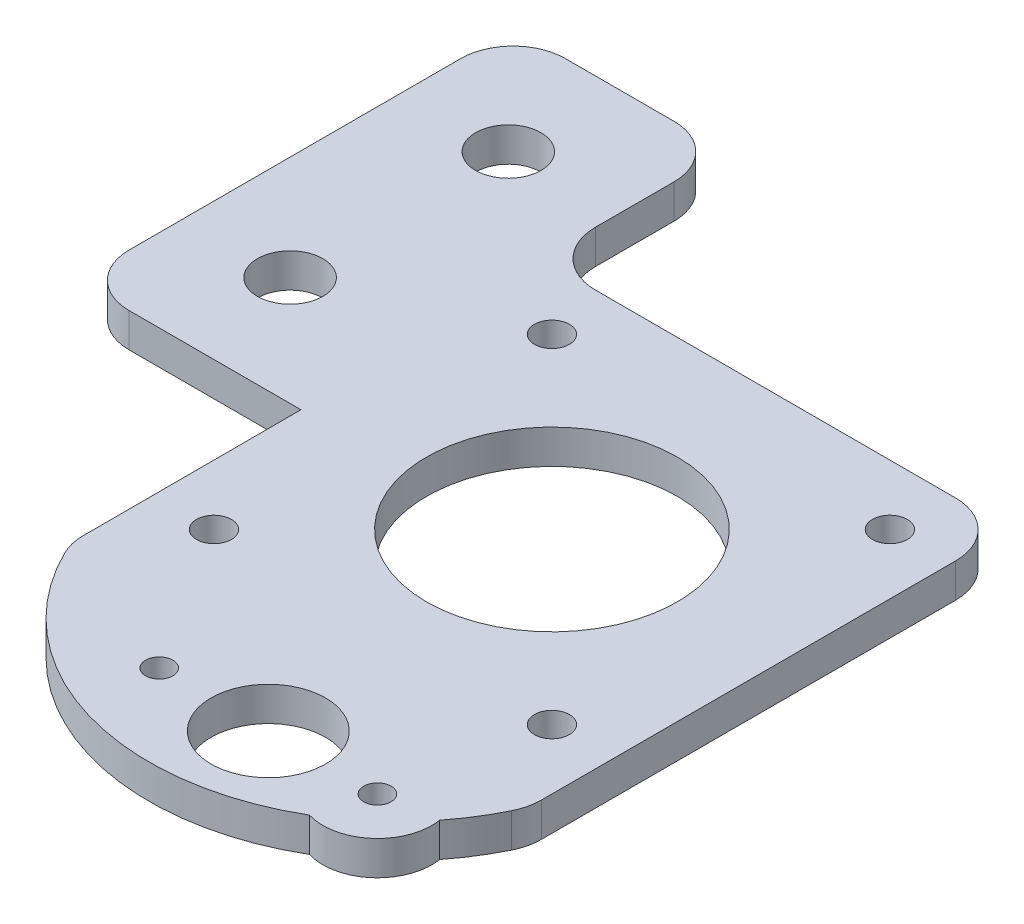
from build123d import *

# Parameters (mm, degrees)
BASE_FLANGE1_DEPTH           = 3.125
F_10_5_10_5_DIAMETER_HOLE1_D = 10.5
F_3_2_3_2_DIAMETER_HOLE1_D   = 3.2
F_23_0_23_DIAMETER_HOLE1_D   = 23
F_6_0_6_DIAMETER_HOLE1_D     = 6
F_2_5_2_5_DIAMETER_HOLE1_D   = 2.5


# Sheet-metal steps are written as plain solids
with BuildPart() as part:
    # Sketch11 → Base-Flange1 (new body)
    with BuildSketch(Plane.XZ.offset(-546.875)):
        with BuildLine():
            Line((22.410254546, -39.506758362), (32.373254546, -39.506758362))
            ThreePointArc((32.373254546, -39.506758362), (35.767367096, -38.100870912), (37.173254546, -34.706758362))
            Line((37.173254546, -34.706758362), (37.173254546, -27.506758362))
            ThreePointArc((37.173254546, -27.506758362), (38.63772064, -23.971224456), (42.173254546, -22.506758362))
            Line((42.173254546, -22.506758362), (75.173254546, -22.506758362))
            ThreePointArc((75.173254546, -22.506758362), (78.708788452, -21.042292268), (80.173254546, -17.506758362))
            Line((80.173254546, -17.506758362), (80.173254546, 20.461534485))
            ThreePointArc((80.173254546, 20.461534485), (80.043518399, 21.59313954), (79.661042546, 22.666020563))
            ThreePointArc((79.661042546, 22.666020563), (78.493233643, 24.758111736), (77.112510881, 26.71623016))
            ThreePointArc((77.112510881, 26.71623016), (75.461078133, 31.260231972), (70.735506318, 32.282070323))
            ThreePointArc((70.735506318, 32.282070323), (52.617226801, 34.461366888), (38.694730703, 22.663676919))
            ThreePointArc((38.694730703, 22.663676919), (38.312910767, 21.593045514), (38.182772618, 20.463841312))
            Line((38.182772618, 20.463841312), (38.16624905, 0.493241638))
            Line((38.16624905, 0.493241638), (22.410254546, 0.493241638))
            ThreePointArc((22.410254546, 0.493241638), (19.016141997, -0.912645812), (17.610254546, -4.306758362))
            Line((17.610254546, -4.306758362), (17.610254546, -34.706758362))
            ThreePointArc((17.610254546, -34.706758362), (19.016141997, -38.100870912), (22.410254546, -39.506758362))
        make_face()
    extrude(amount=-BASE_FLANGE1_DEPTH)

    # Ø10.5 (10.5) Diameter Hole1 (through all)
    with Locations(Plane(origin=(0, 546.875, 0), x_dir=(-1, 0, 0), z_dir=(0, -1, 0))):
        with Locations((-62.173254546, -27.493241638)):
            Hole(F_10_5_10_5_DIAMETER_HOLE1_D / 2)

    # Ø3.2 (3.2) Diameter Hole1 (through all)
    with Locations(Plane(origin=(0, 546.875, 0), x_dir=(-1, 0, 0), z_dir=(0, -1, 0))):
        with Locations((-74.664196355, -13.984183447), (-43.682312737, -13.984183447), (-43.682312737, 16.997700171), (-74.664196355, 16.997700171)):
            Hole(F_3_2_3_2_DIAMETER_HOLE1_D / 2)

    # Ø23.0 (23) Diameter Hole1 (through all)
    with Locations(Plane(origin=(0, 546.875, 0), x_dir=(-1, 0, 0), z_dir=(0, -1, 0))):
        with Locations((-59.173254546, 1.506758362)):
            Hole(F_23_0_23_DIAMETER_HOLE1_D / 2)

    # Ø6.0 (6) Diameter Hole1 (through all)
    with Locations(Plane(origin=(0, 546.875, 0), x_dir=(-1, 0, 0), z_dir=(0, -1, 0))):
        with Locations((-27.173254546, 9.506758362), (-27.173254546, 29.506758362)):
            Hole(F_6_0_6_DIAMETER_HOLE1_D / 2)

    # Ø2.5 (2.5) Diameter Hole1 (through all)
    with Locations(Plane(origin=(0, 546.875, 0), x_dir=(-1, 0, 0), z_dir=(0, -1, 0))):
        with Locations((-72.173254546, -27.493241653), (-52.173254546, -27.493241653)):
            Hole(F_2_5_2_5_DIAMETER_HOLE1_D / 2)


solid = part.part
